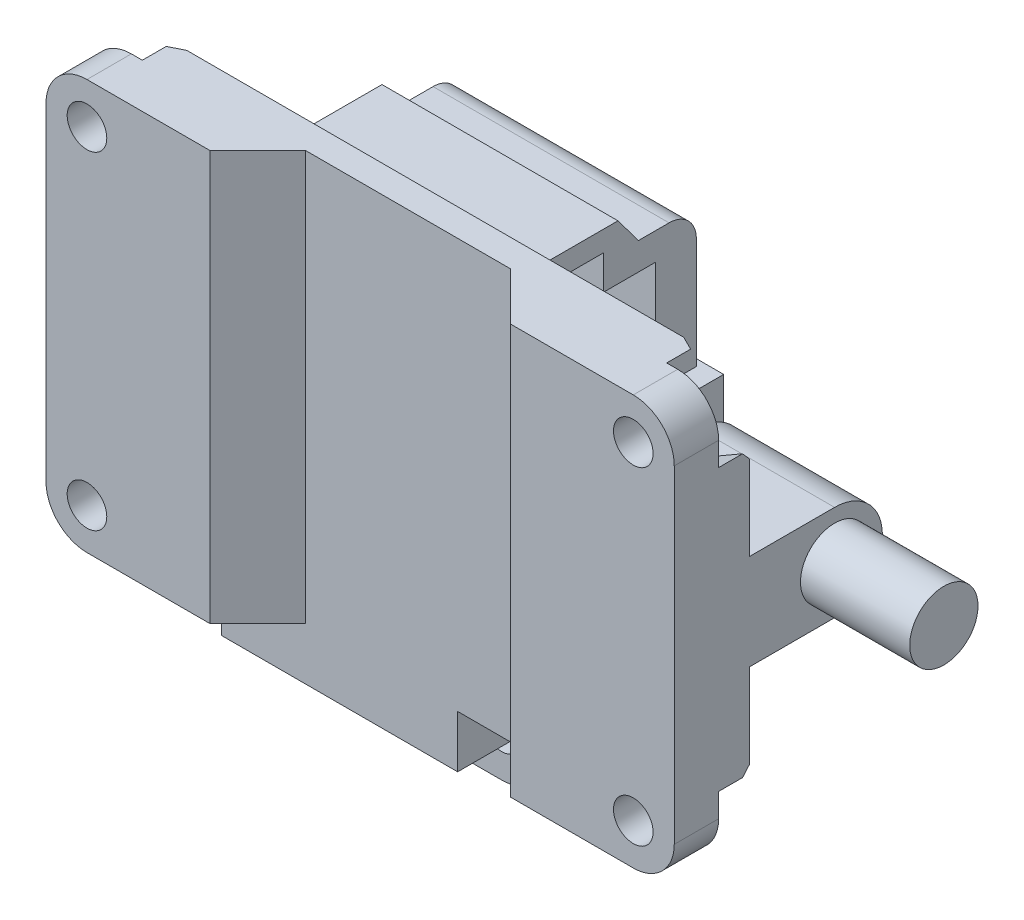
from build123d import *

# Parameters (mm, degrees)
MICRO_SERVO_MOUNT_BASE_PART_CAMERA_TUR_DEPTH = 17.2796
MICRO_START                                  = -8.24
MICRO_SERVO_MOUNT_BASE_PART_CAMERA_3_O_R     = 1.2
MICRO_SERVO_MOUNT_BASE_PART_CAMERA_3_DEPTH   = 16.48
SKETCH7_W                                    = 46
SKETCH7_H                                    = 30
BOSS_EXTRUDE1_DEPTH                          = 3.5
BOSS_EXTRUDE1_DIRECTION_2_REACH              = 35.842
M2_5_CLEARANCE_HOLE1_D                       = 2.9
FILLET1_R                                    = 3
BOSS_EXTRUDE2_DEPTH                          = 10
SKETCH11_R                                   = 2.5
BOSS_EXTRUDE3_DEPTH                          = 8
SKETCH14_W                                   = 17.2796
SKETCH14_H                                   = 27.0711
BOSS_EXTRUDE5_DEPTH                          = 1
BOSS_EXTRUDE4_DEPTH                          = 5
SKETCH13_W                                   = 1.5
SKETCH13_H                                   = 4.25
CUT_EXTRUDE1_DEPTH                           = 39.791353434
FILLET2_R                                    = 2
CUT_EXTRUDE2_DEPTH                           = 2.25
CUT_EXTRUDE3_DEPTH                           = 61.415771958
CHAMFER1_SIZE                                = 0.5


with BuildPart() as part:
    # Micro Servo Mount Base Part - Camera Tur: read off the stored shape, not the designer's step
    # Micro Servo Mount Base Part - Camera 2 → Micro Servo Mount Base Part - Camera Tur (new body)
    with BuildSketch(Plane.YZ):
        Polygon((-23.9811, 0.5), (-16.8311, 0.5), (-16.8311, 6.24), (6.24, 6.24), (6.24, 2.4478), (8.74, 2.4478), (8.74, -2.4478), (6.24, -2.4478), (6.24, -6.24), (-16.8311, -6.24), (-16.8311, -0.5), (-23.9811, -0.5), (-23.9811, -2), (-18.8311, -2), (-18.8311, -8.24), (8.24, -8.24), (8.24, -5), (10.24, -3.5), (10.24, 3.5), (8.24, 5), (8.24, 8.24), (-18.8311, 8.24), (-18.8311, 2), (-23.9811, 2), align=None)
    extrude(amount=MICRO_SERVO_MOUNT_BASE_PART_CAMERA_TUR_DEPTH)

    # Micro Servo Mount Base Part - Camera 3 o → Micro Servo Mount Base Part - Camera 3 (cut)
    with BuildSketch(Plane.XY.offset(MICRO_START)):
        with BuildLine():
            Line((0, -23.9811), (3, -23.9811))
            ThreePointArc((3, -23.9811), (0.878679656, -23.102420344), (0, -20.9811))
            Line((0, -20.9811), (0, -23.9811))
        make_face()
        with BuildLine():
            ThreePointArc((17.2796, -20.9811), (16.400920344, -23.102420344), (14.2796, -23.9811))
            Line((14.2796, -23.9811), (17.2796, -23.9811))
            Line((17.2796, -23.9811), (17.2796, -20.9811))
        make_face()
        with Locations((3, -20.9811)):
            Circle(MICRO_SERVO_MOUNT_BASE_PART_CAMERA_3_O_R)
        with Locations((14.2796, -20.9811)):
            Circle(MICRO_SERVO_MOUNT_BASE_PART_CAMERA_3_O_R)
    extrude(amount=MICRO_SERVO_MOUNT_BASE_PART_CAMERA_3_DEPTH, mode=Mode.SUBTRACT)

    # Sketch7 → Boss-Extrude1 (add)
    with BuildSketch(Plane.XY.offset(8.24)):
        with Locations((13.6398, 0)):
            Rectangle(SKETCH7_W, SKETCH7_H)
    extrude(amount=BOSS_EXTRUDE1_DEPTH)

    # Boss-Extrude1 direction 2: up to this face of the body (flat: up to its plane)
    boss_extrude1_direction_2_end = Plane(part.part.faces().sort_by_distance((8.6398, -5.29555, 6.24))[0])
    # Sketch7 → Boss-Extrude1 direction 2 (add, up to the picked face)
    with BuildSketch(Plane.XY.offset(8.24), mode=Mode.PRIVATE) as boss_extrude1_direction_2_sk1:
        with Locations((13.6398, 0)):
            Rectangle(SKETCH7_W, SKETCH7_H)
    boss_extrude1_direction_2_tool1 = split(extrude(boss_extrude1_direction_2_sk1.sketch, amount=-BOSS_EXTRUDE1_DIRECTION_2_REACH, mode=Mode.PRIVATE), bisect_by=boss_extrude1_direction_2_end, keep=Keep.BOTH, mode=Mode.PRIVATE)
    add(boss_extrude1_direction_2_tool1.solids().sort_by(Axis((13.6398, 0, 8.24), (0, 0, -1)))[0])

    # M2.5 Clearance Hole1 (through all)
    with Locations(Plane.XY.offset(11.74)):
        with Locations((-6.3602, 12), (33.6398, 12), (33.6398, -12), (-6.3602, -12)):
            Hole(M2_5_CLEARANCE_HOLE1_D / 2)

    # Fillet1
    fillet1_edges = [part.edges().sort_by_distance(p)[0] for p in [
        (36.6398, -15, 8.99),
        (-9.3602, 15, 8.99),
        (-9.3602, -15, 8.99),
        (36.6398, 15, 8.99),
    ]]
    fillet(fillet1_edges, radius=FILLET1_R)

    # Sketch10 → Boss-Extrude2 (add)
    with BuildSketch(Plane(origin=(36.6398, 0, 0), x_dir=(0, 0, -1), z_dir=(1, 0, 0))):
        with BuildLine():
            Line((-6.24, 3.5), (0, 3.5))
            ThreePointArc((0, 3.5), (3.5, 0), (0, -3.5))
            Line((0, -3.5), (-6.24, -3.5))
            Line((-6.24, -3.5), (-6.24, 3.5))
        make_face()
    extrude(amount=-BOSS_EXTRUDE2_DEPTH)

    # Sketch11 → Boss-Extrude3 (add)
    with BuildSketch(Plane(origin=(36.6398, 0, 0), x_dir=(0, 0, -1), z_dir=(1, 0, 0))):
        Circle(SKETCH11_R)
    extrude(amount=BOSS_EXTRUDE3_DEPTH)

    # Sketch14 → Boss-Extrude5 (add)
    with BuildSketch(Plane(origin=(0, 0, -8.24), x_dir=(-1, 0, 0), z_dir=(0, 0, -1))):
        with Locations((-8.6398, -5.29555)):
            Rectangle(SKETCH14_W, SKETCH14_H)
    extrude(amount=BOSS_EXTRUDE5_DEPTH)

    # Sketch12 → Boss-Extrude4 (add, symmetric)
    with BuildSketch(Plane(origin=(0, -6.87055, 0), x_dir=(1, 0, 0), z_dir=(0, 1, 0))):
        Polygon((0, 9.74), (0.5148, 9.74), (0.5148, 9.24), (0, 9.24), (0, 6.24), (-1.5, 6.24), (-1.5, 9.74), align=None)
        Polygon((17.2796, 6.24), (18.7796, 6.24), (18.7796, 9.74), (17.2796, 9.74), (16.7648, 9.74), (16.7648, 9.24), (17.2796, 9.24), align=None)
    extrude(amount=BOSS_EXTRUDE4_DEPTH, both=True)

    # Sketch13 → Cut-Extrude1 (cut, through all)
    with BuildSketch(Plane(origin=(18.7796, 0, 0), x_dir=(0, 0, -1), z_dir=(1, 0, 0))):
        with Locations((6.99, -6.87055)):
            Rectangle(SKETCH13_W, SKETCH13_H)
    extrude(amount=-CUT_EXTRUDE1_DEPTH, mode=Mode.SUBTRACT)

    # Fillet2
    fillet2_edges = [part.edges().sort_by_distance(p)[0] for p in [
        (8.6398, -18.8311, -9.24),
        (8.6398, 8.24, -9.24),
    ]]
    fillet(fillet2_edges, radius=FILLET2_R)

    # Sketch15 → Cut-Extrude2 (cut)
    with BuildSketch(Plane(origin=(0, 0, 6.24), x_dir=(-1, 0, 0), z_dir=(0, 0, -1))):
        Polygon((9.3602, 13.732050808), (6.3602, 15.464101615), (3.3602, 13.732050808), (3.3602, 10.267949192), (6.3602, 8.535898385), (9.3602, 10.267949192), align=None)
        Polygon((9.3602, -10.267949192), (6.3602, -8.535898385), (3.3602, -10.267949192), (3.3602, -13.732050808), (6.3602, -15.464101615), (9.3602, -13.732050808), align=None)
        Polygon((-36.6398, -10.267949192), (-36.6398, -13.732050808), (-33.6398, -15.464101615), (-30.6398, -13.732050808), (-30.6398, -10.267949192), (-33.6398, -8.535898385), align=None)
        Polygon((-36.6398, 13.732050808), (-36.6398, 10.267949192), (-33.6398, 8.535898385), (-30.6398, 10.267949192), (-30.6398, 13.732050808), (-33.6398, 15.464101615), align=None)
    extrude(amount=-CUT_EXTRUDE2_DEPTH, mode=Mode.SUBTRACT)

    # Sketch16 → Cut-Extrude3 (cut, through all)
    with BuildSketch(Plane(origin=(0, 15, 0), x_dir=(1, 0, 0), z_dir=(0, 1, 0))):
        Polygon((2.6398, -11.74), (6.1398, -8.24), (21.1398, -8.24), (24.6398, -11.74), align=None)
    extrude(amount=-CUT_EXTRUDE3_DEPTH, mode=Mode.SUBTRACT)

    # Chamfer1
    chamfer1_edges = [part.edges().sort_by_distance(p)[0] for p in [
        (35.1398, 9.401923789, 6.24),
        (32.1398, 9.401923789, 6.24),
        (30.6398, 12, 6.24),
        (31.737876211, 14.366025404, 6.24),
        (31.737876211, -14.366025404, 6.24),
        (30.6398, -12, 6.24),
        (32.1398, -9.401923789, 6.24),
        (35.1398, -9.401923789, 6.24),
        (-7.8602, -9.401923789, 6.24),
        (-4.8602, -9.401923789, 6.24),
        (-3.3602, -12, 6.24),
        (-4.458276211, -14.366025404, 6.24),
        (-4.458276211, 14.366025404, 6.24),
        (-3.3602, 12, 6.24),
        (-4.8602, 9.401923789, 6.24),
        (-7.8602, 9.401923789, 6.24),
    ]]
    chamfer(chamfer1_edges, length=CHAMFER1_SIZE)


solid = part.part
